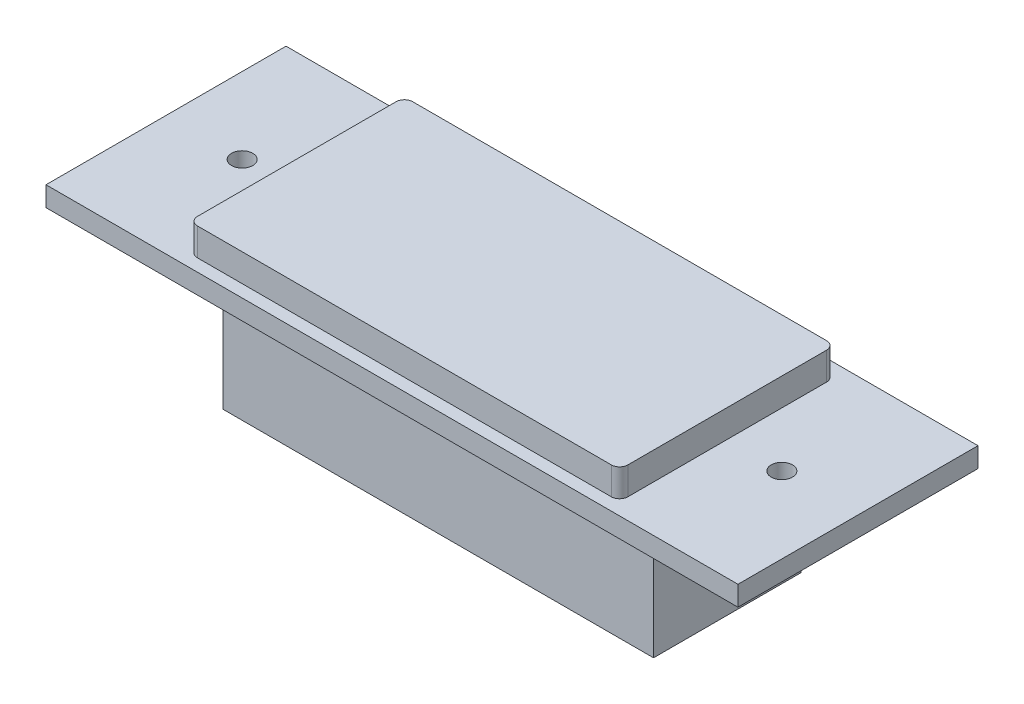
from build123d import *

# Parameters (mm, degrees)
SKETCH1_W             = 66.04
SKETCH1_H             = 33.02
BOSS_EXTRUDE1_DEPTH   = 4.2418
FILLET1_R             = 1.27
SKETCH2_W             = 106.172
SKETCH2_H             = 36.83
BOSS_EXTRUDE2_DEPTH   = 3.048
F_4_CLEARANCE_HOLE1_D = 3.2639
SKETCH6_W             = 66.04
SKETCH6_H             = 22.606
BOSS_EXTRUDE3_DEPTH   = 20.32


with BuildPart() as part:
    # Sketch1 → Boss-Extrude1 (new body)
    with BuildSketch(Plane(origin=(0, 0, 0), x_dir=(1, 0, 0), z_dir=(0, 1, 0))):
        Rectangle(SKETCH1_W, SKETCH1_H)
    extrude(amount=BOSS_EXTRUDE1_DEPTH)

    # Fillet1
    fillet1_edges = [part.edges().sort_by_distance(p)[0] for p in [
        (33.02, 2.1209, 16.51),
        (33.02, 2.1209, -16.51),
        (-33.02, 2.1209, -16.51),
        (-33.02, 2.1209, 16.51),
    ]]
    fillet(fillet1_edges, radius=FILLET1_R)

    # Sketch2 → Boss-Extrude2 (add)
    with BuildSketch(Plane.XZ):
        Rectangle(SKETCH2_W, SKETCH2_H)
    extrude(amount=BOSS_EXTRUDE2_DEPTH)

    # #4 Clearance Hole1 (through all)
    with Locations(Plane(origin=(0, 0, 0), x_dir=(1, 0, 0), z_dir=(0, 1, 0))):
        with Locations((-41.402, 0), (41.402, 0)):
            Hole(F_4_CLEARANCE_HOLE1_D / 2)

    # Sketch6 → Boss-Extrude3 (add)
    with BuildSketch(Plane.XZ.offset(3.048)):
        Rectangle(SKETCH6_W, SKETCH6_H)
    extrude(amount=BOSS_EXTRUDE3_DEPTH)


solid = part.part
